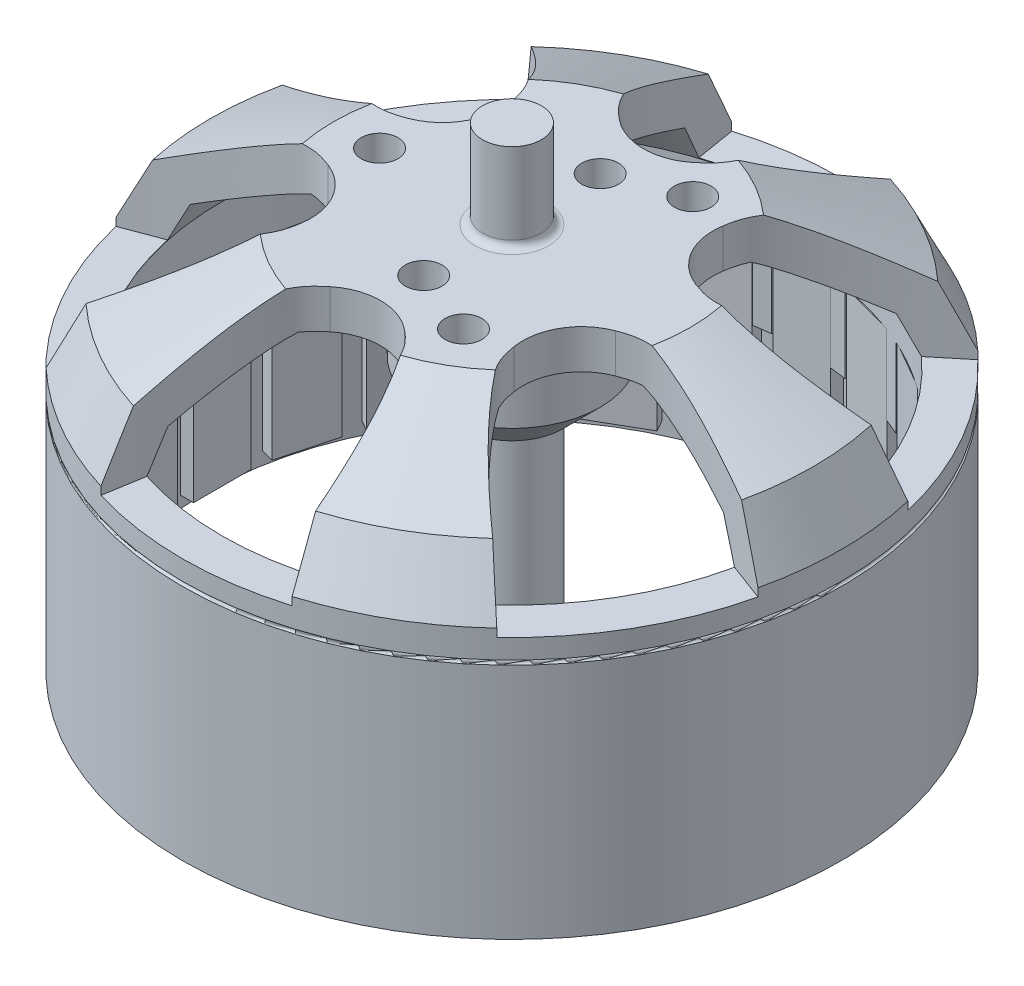
from build123d import *

# Parameters (mm, degrees)
SKETCH1_R           = 22.41
BOSS_EXTRUDE1_DEPTH = 13.125
SKETCH3_R           = 2
BOSS_EXTRUDE2_DEPTH = 6
SKETCH9_R           = 6
BOSS_EXTRUDE3_DEPTH = 7.6
SKETCH10_R          = 2.5
BOSS_EXTRUDE4_DEPTH = 26.74
CHAMFER1_SIZE       = 2.5
CUT_EXTRUDE3_DEPTH  = 8.47
SKETCH8_R           = 1.25
CUT_EXTRUDE4_DEPTH  = 17.78
FILLET2_R           = 0.5
SKETCH11_R          = 0.15
CUT_EXTRUDE5_START  = -9
SKETCH12_R          = 20.86
SKETCH12_R_2        = 19.75
CUT_EXTRUDE5_DEPTH  = 9
SKETCH13_W          = 4
SKETCH13_H          = 1
CUT_EXTRUDE6_DEPTH  = 5.36
CIRPATTERN1_COUNT   = 24
BOSS_EXTRUDE5_START = -5.36
SKETCH14_W          = 3.9
SKETCH14_H          = 0.9
BOSS_EXTRUDE5_DEPTH = 13.36
CIRPATTERN2_COUNT   = 24


# Read off the part's stored shape, not the designer's step: Shell3
with BuildPart() as part:
    # Sketch1 → Boss-Extrude1 (new, symmetric)
    with BuildSketch(Plane(origin=(0, 0, 0), x_dir=(1, 0, 0), z_dir=(0, 1, 0))):
        with Locations(Location((0, 0, 0), (0, 0, 270))):
            Circle(SKETCH1_R)
    extrude(amount=BOSS_EXTRUDE1_DEPTH, both=True)

    # Sketch2 → Cut-Revolve1 (revolve, cut)
    with BuildSketch(Plane.XY):
        Polygon((12.125, 13.125), (20.5, 9.125), (22.41, 5.199254432), (24.144541961, 16.755759732), align=None)
    revolve(axis=Axis((0, 0, 0), (0, 1, 0)), mode=Mode.SUBTRACT)

    # Sketch3 → Boss-Extrude2 (add)
    with BuildSketch(Plane(origin=(0, 13.125, 0), x_dir=(1, 0, 0), z_dir=(0, 1, 0))):
        with Locations(Location((0, 0, 0), (0, 0, 270))):
            Circle(SKETCH3_R)
    extrude(amount=BOSS_EXTRUDE2_DEPTH)

    # Shell3 outline → Shell3 (revolve, cut)
    with BuildSketch(Plane.XY):
        Polygon((11.522378735, 10.465), (0, 10.465), (0, -13.125), (19.75, -13.125), (19.75, 4.586504461), (18.514770955, 7.125349985), align=None)
    revolve(axis=Axis((0, 0, 0), (0, 1, 0)), mode=Mode.SUBTRACT)

    # Sketch9 → Boss-Extrude3 (add)
    with BuildSketch(Plane.XZ.offset(-10.465)):
        with Locations(Location((0, 0, 0), (0, 0, 90))):
            Circle(SKETCH9_R)
    extrude(amount=BOSS_EXTRUDE3_DEPTH)

    # Sketch10 → Boss-Extrude4 (add)
    with BuildSketch(Plane.XZ.offset(-2.865)):
        with Locations(Location((0, 0, 0), (0, 0, 90))):
            Circle(SKETCH10_R)
    extrude(amount=BOSS_EXTRUDE4_DEPTH)

    # Chamfer1
    chamfer1_edges = [part.edges().sort_by_distance(p)[0] for p in [
        (0, 2.865, -6),
    ]]
    chamfer(chamfer1_edges, length=CHAMFER1_SIZE)

    # Sketch7 → Cut-Extrude3 (cut)
    with BuildSketch(Plane(origin=(0, 13.125, 0), x_dir=(1, 0, 0), z_dir=(0, 1, 0))):
        with BuildLine():
            ThreePointArc((-2.52312697, 9.831158784), (0, 8.935), (2.52312697, 9.831158784))
            add(Edge.make_bspline(
                [(6.5, 21.446633768), (5.859511057, 17.193475433), (5.06193484, 13.972642481), (3.633974534, 10.881310509), (3.137031471, 10.33020461), (2.52312697, 9.831158784)],
                knots=[0, 0, 0, 0, 0.63597512, 0.728930054, 0.929549338, 0.929549338, 0.929549338, 0.929549338], degree=3))
            ThreePointArc((6.5, 21.446633768), (0, 22.41), (-6.5, 21.446633768))
            add(Edge.make_bspline(
                [(-6.5, 21.446633768), (-5.859511057, 17.193475433), (-5.06193484, 13.972642481), (-3.633974534, 10.881310509), (-3.137031471, 10.33020461), (-2.52312697, 9.831158784)],
                knots=[0, 0, 0, 0, 0.63597512, 0.728930054, 0.929549338, 0.929549338, 0.929549338, 0.929549338], degree=3))
        make_face()
        with BuildLine():
            ThreePointArc((21.823329669, 5.09415176), (19.407629299, 11.205), (15.323329669, 16.352482009))
            add(Edge.make_bspline(
                [(15.323329669, 16.352482009), (11.960230976, 13.671223145), (9.569695927, 11.370085404), (7.60650406, 8.587769518), (7.377703883, 7.881851251), (7.252469771, 7.100671445)],
                knots=[0, 0, 0, 0, 0.63597512, 0.728930054, 0.929549338, 0.929549338, 0.929549338, 0.929549338], degree=3))
            ThreePointArc((7.252469771, 7.100671445), (7.737936983, 4.4675), (9.775596741, 2.730487339))
            add(Edge.make_bspline(
                [(21.823329669, 5.09415176), (17.819742032, 3.522252287), (14.631630767, 2.602557077), (11.240478595, 2.293540991), (10.514735354, 2.448353359), (9.775596741, 2.730487339)],
                knots=[0, 0, 0, 0, 0.63597512, 0.728930054, 0.929549338, 0.929549338, 0.929549338, 0.929549338], degree=3))
        make_face()
        with BuildLine():
            ThreePointArc((15.323329669, -16.352482009), (19.407629299, -11.205), (21.823329669, -5.09415176))
            add(Edge.make_bspline(
                [(21.823329669, -5.09415176), (17.819742032, -3.522252287), (14.631630767, -2.602557077), (11.240478595, -2.293540991), (10.514735354, -2.448353359), (9.775596741, -2.730487339)],
                knots=[0, 0, 0, 0, 0.63597512, 0.728930054, 0.929549338, 0.929549338, 0.929549338, 0.929549338], degree=3))
            ThreePointArc((9.775596741, -2.730487339), (7.737936983, -4.4675), (7.252469771, -7.100671445))
            add(Edge.make_bspline(
                [(15.323329669, -16.352482009), (11.960230976, -13.671223145), (9.569695927, -11.370085404), (7.60650406, -8.587769518), (7.377703883, -7.881851251), (7.252469771, -7.100671445)],
                knots=[0, 0, 0, 0, 0.63597512, 0.728930054, 0.929549338, 0.929549338, 0.929549338, 0.929549338], degree=3))
        make_face()
        with BuildLine():
            ThreePointArc((-6.5, -21.446633768), (0, -22.41), (6.5, -21.446633768))
            add(Edge.make_bspline(
                [(6.5, -21.446633768), (5.859511057, -17.193475433), (5.06193484, -13.972642481), (3.633974534, -10.881310509), (3.137031471, -10.33020461), (2.52312697, -9.831158784)],
                knots=[0, 0, 0, 0, 0.63597512, 0.728930054, 0.929549338, 0.929549338, 0.929549338, 0.929549338], degree=3))
            ThreePointArc((2.52312697, -9.831158784), (0, -8.935), (-2.52312697, -9.831158784))
            add(Edge.make_bspline(
                [(-6.5, -21.446633768), (-5.859511057, -17.193475433), (-5.06193484, -13.972642481), (-3.633974534, -10.881310509), (-3.137031471, -10.33020461), (-2.52312697, -9.831158784)],
                knots=[0, 0, 0, 0, 0.63597512, 0.728930054, 0.929549338, 0.929549338, 0.929549338, 0.929549338], degree=3))
        make_face()
        with BuildLine():
            ThreePointArc((-21.823329669, -5.09415176), (-19.407629299, -11.205), (-15.323329669, -16.352482009))
            add(Edge.make_bspline(
                [(-15.323329669, -16.352482009), (-11.960230976, -13.671223145), (-9.569695927, -11.370085404), (-7.60650406, -8.587769518), (-7.377703883, -7.881851251), (-7.252469771, -7.100671445)],
                knots=[0, 0, 0, 0, 0.63597512, 0.728930054, 0.929549338, 0.929549338, 0.929549338, 0.929549338], degree=3))
            ThreePointArc((-7.252469771, -7.100671445), (-7.737936983, -4.4675), (-9.775596741, -2.730487339))
            add(Edge.make_bspline(
                [(-21.823329669, -5.09415176), (-17.819742032, -3.522252287), (-14.631630767, -2.602557077), (-11.240478595, -2.293540991), (-10.514735354, -2.448353359), (-9.775596741, -2.730487339)],
                knots=[0, 0, 0, 0, 0.63597512, 0.728930054, 0.929549338, 0.929549338, 0.929549338, 0.929549338], degree=3))
        make_face()
        with BuildLine():
            ThreePointArc((-15.323329669, 16.352482009), (-19.407629299, 11.205), (-21.823329669, 5.09415176))
            add(Edge.make_bspline(
                [(-21.823329669, 5.09415176), (-17.819742032, 3.522252287), (-14.631630767, 2.602557077), (-11.240478595, 2.293540991), (-10.514735354, 2.448353359), (-9.775596741, 2.730487339)],
                knots=[0, 0, 0, 0, 0.63597512, 0.728930054, 0.929549338, 0.929549338, 0.929549338, 0.929549338], degree=3))
            ThreePointArc((-9.775596741, 2.730487339), (-7.737936983, 4.4675), (-7.252469771, 7.100671445))
            add(Edge.make_bspline(
                [(-15.323329669, 16.352482009), (-11.960230976, 13.671223145), (-9.569695927, 11.370085404), (-7.60650406, 8.587769518), (-7.377703883, 7.881851251), (-7.252469771, 7.100671445)],
                knots=[0, 0, 0, 0, 0.63597512, 0.728930054, 0.929549338, 0.929549338, 0.929549338, 0.929549338], degree=3))
        make_face()
    extrude(amount=-CUT_EXTRUDE3_DEPTH, mode=Mode.SUBTRACT)

    # Sketch8 → Cut-Extrude4 (cut)
    with BuildSketch(Plane(origin=(0, 13.125, 0), x_dir=(1, 0, 0), z_dir=(0, 1, 0))):
        with Locations(Location((4.5, 7.794228634, 0), (0, 0, 270))):
            Circle(SKETCH8_R)
        with Locations(Location((4.5, -7.794228634, 0), (0, 0, 270))):
            Circle(SKETCH8_R)
        with Locations(Location((-9, 0, 0), (0, 0, 270))):
            Circle(SKETCH8_R)
        with Locations(Location((0, 6, 0), (0, 0, 270))):
            Circle(SKETCH8_R)
        with Locations(Location((0, -6, 0), (0, 0, 5.979156796))):
            Circle(SKETCH8_R)
    extrude(amount=-CUT_EXTRUDE4_DEPTH, mode=Mode.SUBTRACT)

    # Fillet2
    fillet2_edges = [part.edges().sort_by_distance(p)[0] for p in [
        (0, 13.125, -2),
    ]]
    fillet(fillet2_edges, radius=FILLET2_R)

    # Sketch11 → Cut-Revolve3 (revolve, cut)
    with BuildSketch(Plane.XY, mode=Mode.PRIVATE) as cut_revolve3_sk:
        with Locations((-22.41, 3.175)):
            Circle(SKETCH11_R)
    revolve(cut_revolve3_sk.sketch.rotate(Axis((0, 0, 0), (0, -1, 0)), 270), axis=Axis((0, 0, 0), (0, -1, 0)), mode=Mode.SUBTRACT)

    # Sketch12 → Cut-Extrude5 (cut)
    with BuildSketch(Plane(origin=(0, -13.125, 0), x_dir=(-1, 0, 0), z_dir=(0, -1, 0)).offset(CUT_EXTRUDE5_START)):
        with Locations(Location((0, 0, 0), (0, 0, 90))):
            Circle(SKETCH12_R)
        with Locations(Location((0, 0, 0), (0, 0, 90))):
            Circle(SKETCH12_R_2, mode=Mode.SUBTRACT)
    extrude(amount=CUT_EXTRUDE5_DEPTH, mode=Mode.SUBTRACT)

    # Sketch13 → Cut-Extrude6 (cut)
    with BuildSketch(Plane(origin=(0, -4.125, 0), x_dir=(-1, 0, 0), z_dir=(0, -1, 0))):
        with Locations((0, -20.148473223)):
            Rectangle(SKETCH13_W, SKETCH13_H)
    cut_extrude6 = extrude(amount=-CUT_EXTRUDE6_DEPTH, mode=Mode.SUBTRACT)

    # CirPattern1: Cut-Extrude6 ×24 about axis
    cirpattern1_axis = Axis((0, 0, 0), (0, 1, 0))
    for i in range(1, CIRPATTERN1_COUNT):
        add(cut_extrude6.rotate(cirpattern1_axis, i * 360 / CIRPATTERN1_COUNT), mode=Mode.SUBTRACT)

    # Sketch14 → Boss-Extrude5 (add)
    with BuildSketch(Plane.XZ.offset(4.125).offset(BOSS_EXTRUDE5_START)):
        with Locations((0, 20.148473223)):
            Rectangle(SKETCH14_W, SKETCH14_H)
    boss_extrude5 = extrude(amount=BOSS_EXTRUDE5_DEPTH)

    # CirPattern2: Boss-Extrude5 ×24 about axis
    cirpattern2_axis = Axis((0, 0, 0), (0, 1, 0))
    for i in range(1, CIRPATTERN2_COUNT):
        add(boss_extrude5.rotate(cirpattern2_axis, i * 360 / CIRPATTERN2_COUNT))


solid = part.part
